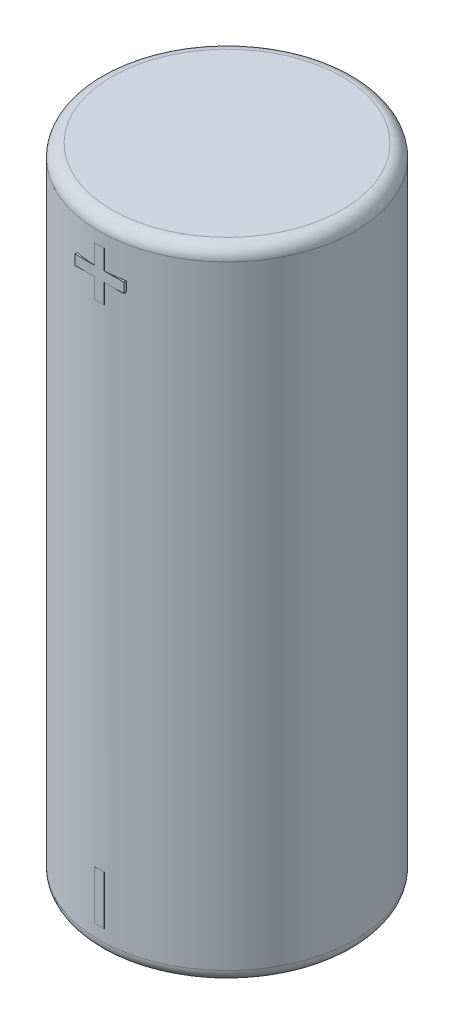
from build123d import *

# Parameters (mm, degrees)
SKETCH1_R           = 13
BOSS_EXTRUDE1_DEPTH = 65
FILLET1_R           = 1.27
FILLET2_R           = 1.27
SKETCH2_W           = 1
SKETCH2_H           = 5
BOSS_EXTRUDE2_DEPTH = 10


with BuildPart() as part:
    # Sketch1 → Boss-Extrude1 (new body)
    with BuildSketch(Plane(origin=(0, 0, 0), x_dir=(1, 0, 0), z_dir=(0, 1, 0))):
        Circle(SKETCH1_R)
    extrude(amount=BOSS_EXTRUDE1_DEPTH)

    # Fillet1
    fillet1_edges = [part.edges().sort_by_distance(p)[0] for p in [
        (-13, 65, 0),
    ]]
    fillet(fillet1_edges, radius=FILLET1_R)

    # Fillet2
    fillet2_edges = [part.edges().sort_by_distance(p)[0] for p in [
        (-13, 0, 0),
    ]]
    fillet(fillet2_edges, radius=FILLET2_R)

    # Sketch2 → Boss-Extrude2 (add)
    with BuildSketch(Plane.XY.offset(13)):
        Polygon((0.5, 62.5), (-0.5, 62.5), (-0.5, 60.5), (-2.5, 60.5), (-2.5, 59.5), (-0.5, 59.5), (-0.5, 57.5), (0.5, 57.5), (0.5, 59.5), (2.5, 59.5), (2.5, 60.5), (0.5, 60.5), align=None)
        with Locations((0, 5)):
            Rectangle(SKETCH2_W, SKETCH2_H)
    extrude(amount=-BOSS_EXTRUDE2_DEPTH)


solid = part.part
